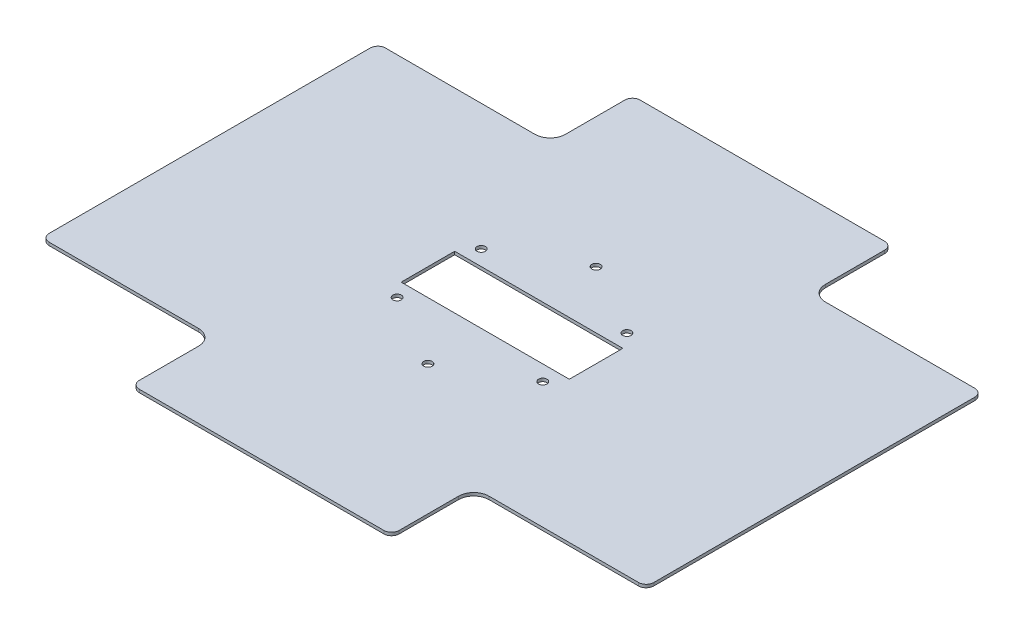
from build123d import *

# Parameters (mm, degrees)
EXTRUDE_1_DEPTH     = 2
SKETCH_4_R          = 2.75
CUT_EXTRUDE_1_DEPTH = 257.804736208
SKETCH_5_W          = 110
SKETCH_5_H          = 35
CUT_EXTRUDE_2_DEPTH = 257.804736208


with BuildPart() as part:
    # Эскиз1 → Бобышка-Вытянуть1 (new body)
    with BuildSketch(Plane(origin=(0, 0, 0), x_dir=(1, 0, 0), z_dir=(0, 1, 0))):
        with BuildLine():
            ThreePointArc((-85, -158.805454142), (-83.535533906, -162.340988048), (-80, -163.805454142))
            Line((-80, -163.805454142), (80, -163.805454142))
            ThreePointArc((80, -163.805454142), (83.535533906, -162.340988048), (85, -158.805454142))
            Line((85, -158.805454142), (85, -120))
            ThreePointArc((85, -120), (87.928932188, -112.928932188), (95, -110))
            Line((95, -110), (192.768667216, -110))
            ThreePointArc((192.768667216, -110), (196.304201122, -108.535533906), (197.768667216, -105))
            Line((197.768667216, -105), (197.768667216, 105))
            ThreePointArc((197.768667216, 105), (196.304201122, 108.535533906), (192.768667216, 110))
            Line((192.768667216, 110), (95, 110))
            ThreePointArc((95, 110), (87.928932188, 112.928932188), (85, 120))
            Line((85, 120), (85, 158.805454142))
            ThreePointArc((85, 158.805454142), (83.535533906, 162.340988048), (80, 163.805454142))
            Line((80, 163.805454142), (-80, 163.805454142))
            ThreePointArc((-80, 163.805454142), (-83.535533906, 162.340988048), (-85, 158.805454142))
            Line((-85, 158.805454142), (-85, 120))
            ThreePointArc((-85, 120), (-87.928932188, 112.928932188), (-95, 110))
            Line((-95, 110), (-192.768667216, 110))
            ThreePointArc((-192.768667216, 110), (-196.304201122, 108.535533906), (-197.768667216, 105))
            Line((-197.768667216, 105), (-197.768667216, -105))
            ThreePointArc((-197.768667216, -105), (-196.304201122, -108.535533906), (-192.768667216, -110))
            Line((-192.768667216, -110), (-95, -110))
            ThreePointArc((-95, -110), (-87.928932188, -112.928932188), (-85, -120))
            Line((-85, -120), (-85, -158.805454142))
        make_face()
    extrude(amount=EXTRUDE_1_DEPTH)

    # Эскиз4 → Вырез-Вытянуть1 (cut, through all)
    with BuildSketch(Plane(origin=(0, 2, 0), x_dir=(1, 0, 0), z_dir=(0, 1, 0))):
        with Locations((0, 55)):
            Circle(SKETCH_4_R)
        with Locations((47.631397208, 27.5)):
            Circle(SKETCH_4_R)
        with Locations((47.631397208, -27.5)):
            Circle(SKETCH_4_R)
        with Locations((0, -55)):
            Circle(SKETCH_4_R)
        with Locations((-47.631397208, -27.5)):
            Circle(SKETCH_4_R)
        with Locations((-47.631397208, 27.5)):
            Circle(SKETCH_4_R)
    extrude(amount=-CUT_EXTRUDE_1_DEPTH, mode=Mode.SUBTRACT)

    # Эскиз5 → Вырез-Вытянуть2 (cut, through all)
    with BuildSketch(Plane.XZ):
        Rectangle(SKETCH_5_W, SKETCH_5_H)
    extrude(amount=-CUT_EXTRUDE_2_DEPTH, mode=Mode.SUBTRACT)


solid = part.part
